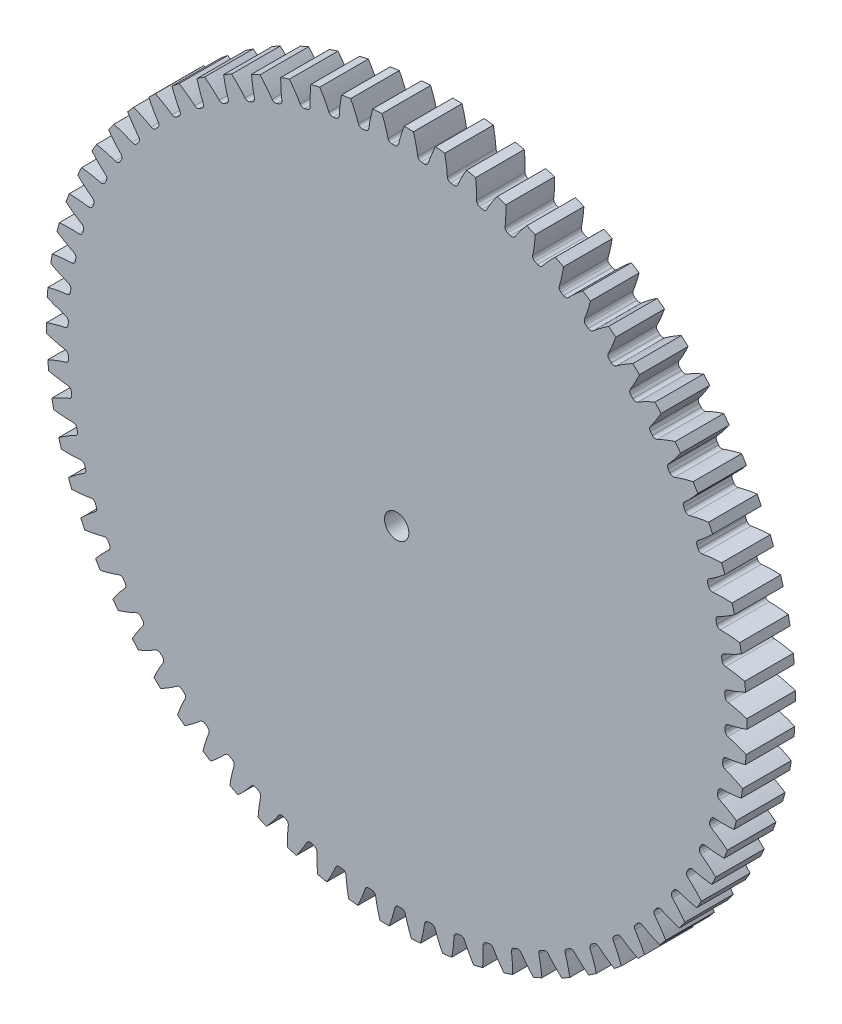
from build123d import *

# Parameters (mm, degrees)
SKETCH3_R         = 91.44
GEARBODY_DEPTH    = 12.7
TOOTHCUT_DEPTH    = 130.937820514
CIRPATTERN1_COUNT = 70
BOREDIA_R         = 3.175
BORE_DEPTH        = 12700


with BuildPart() as part:
    # Sketch3 → gearBody (new body)
    with BuildSketch(Plane.XY):
        Circle(SKETCH3_R)
    extrude(amount=GEARBODY_DEPTH)

    # Sketch2 → toothCut (cut, through all)
    with BuildSketch(Plane.XY):
        with BuildLine():
            ThreePointArc((85.735301754, -3.362135413), (85.749736044, -2.971311128), (85.762388771, -2.580425109))
            ThreePointArc((85.762388771, -2.580425109), (85.998066409, -1.963594516), (86.565759827, -1.626328873))
            ThreePointArc((86.565759827, -1.626328873), (99.045389961, 3.561091386), (108.658433125, 13.060559705))
            ThreePointArc((108.658433125, 13.060559705), (109.374903969, -3.789946002), (107.493779453, -20.550442522))
            ThreePointArc((107.493779453, -20.550442522), (98.561335154, -10.40835516), (86.47070451, -4.369551647))
            ThreePointArc((86.47070451, -4.369551647), (85.927717834, -3.993799867), (85.735301754, -3.362135413))
        make_face()
    toothcut = extrude(amount=TOOTHCUT_DEPTH, mode=Mode.SUBTRACT)

    # CirPattern1: toothCut ×70 about axis
    cirpattern1_axis = Axis((0, 0, 12.7), (0, 0, -1))
    for i in range(1, CIRPATTERN1_COUNT):
        add(toothcut.rotate(cirpattern1_axis, i * 360 / CIRPATTERN1_COUNT), mode=Mode.SUBTRACT)

    # boreDia → bore (cut, symmetric)
    with BuildSketch(Plane.XY):
        Circle(BOREDIA_R)
    extrude(amount=BORE_DEPTH, both=True, mode=Mode.SUBTRACT)


solid = part.part
